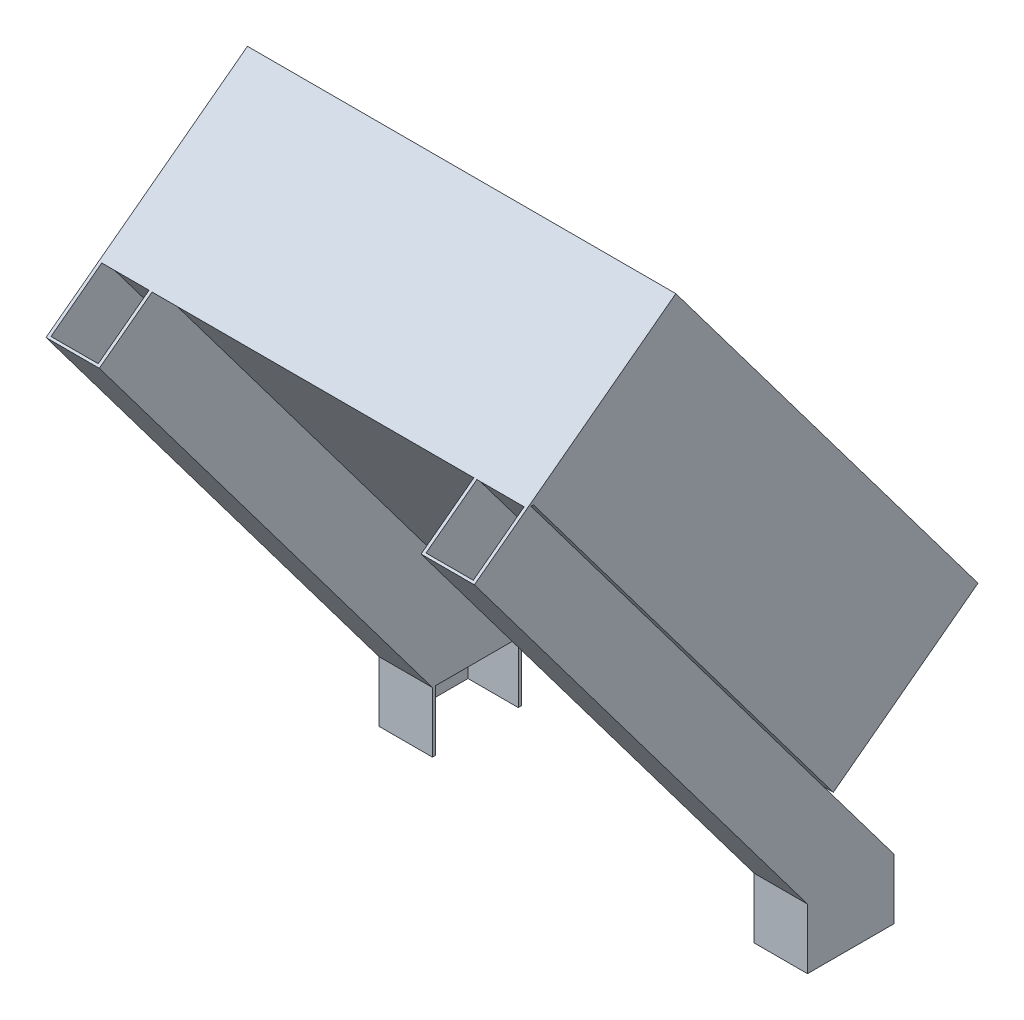
from build123d import *

# Parameters (mm, degrees)
BOSS_EXTRUDE1_DEPTH   = 30
BOSS_EXTRUDE1_2_DEPTH = 30
SWEEP1_START          = -106.5
SWEEP1_DEPTH          = 26.5
SWEEP1_2_DEPTH        = 1.5
SWEEP2_START          = 80
SWEEP2_DEPTH          = 26.5
SWEEP2_START_2        = 105
SWEEP2_2_DEPTH        = 1.5
BOSS_EXTRUDE2_DEPTH   = 1.5
BOSS_EXTRUDE3_DEPTH   = 1.5
SKETCH7_W             = 213
SKETCH7_H             = 44.192821834
BOSS_EXTRUDE4_DEPTH   = 1.5
BOSS_EXTRUDE5_REACH   = 392.115
SKETCH9_W             = 222.593563538
SKETCH9_H             = 76.90916357
CUT_EXTRUDE1_DEPTH    = 487.5


# Read off the part's stored shape, not the designer's step: Sweep1, Sweep2
with BuildPart() as part:
    # Sketch1 → Boss-Extrude1 (new body)
    with BuildSketch(Plane(origin=(0, 0, 0), x_dir=(1, 0, 0), z_dir=(0, 1, 0))):
        Polygon((-80, 0), (-80, -1.5), (-106.5, -1.5), (-106.5, 42.692821834), (-80, 42.692821834), (-80, 41.192821834), (-105, 41.192821834), (-105, 0), align=None)
    extrude(amount=BOSS_EXTRUDE1_DEPTH)

    # Sweep1 outline → Sweep1 (add)
    with BuildSketch(Plane.YZ.offset(SWEEP1_START)):
        Polygon((30, -42.692821834), (270, 137.764932896), (270, 139.264932896), (30, -41.192821834), align=None)
        Polygon((30, 0), (270, 180.45775473), (270, 181.95775473), (30, 1.5), align=None)
    extrude(amount=SWEEP1_DEPTH)

    # Sweep1 2 outline → Sweep1 2 (add)
    with BuildSketch(Plane.YZ.offset(SWEEP1_START)):
        Polygon((30, -41.192821834), (270, 139.264932896), (270, 180.45775473), (30, 0), align=None)
    extrude(amount=SWEEP1_2_DEPTH)

    # Sketch5 → Boss-Extrude2 (add)
    with BuildSketch(Plane(origin=(-80, 0, 0), x_dir=(0, 0, -1), z_dir=(1, 0, 0))):
        Polygon((0, 30), (-180.45775473, 270), (-139.264932896, 270), (41.192821834, 30), align=None)
    extrude(amount=-BOSS_EXTRUDE2_DEPTH)



with BuildPart() as body_2:
    # Sketch1 → Boss-Extrude1 2 (new body)
    with BuildSketch(Plane(origin=(0, 0, 0), x_dir=(1, 0, 0), z_dir=(0, 1, 0))):
        Polygon((80, 0), (105, 0), (105, 40), (80, 40), (80, 41.5), (106.5, 41.5), (106.5, -1.5), (80, -1.5), align=None)
    extrude(amount=BOSS_EXTRUDE1_2_DEPTH)

    # Sweep2 outline → Sweep2 (add)
    with BuildSketch(Plane.YZ.offset(SWEEP2_START)):
        Polygon((270, 180.45775473), (270, 181.95775473), (30, 1.5), (30, 0), align=None)
        Polygon((270, 138.95775473), (270, 140.45775473), (30, -40), (30, -41.5), align=None)
    extrude(amount=SWEEP2_DEPTH)

    # Sweep2 2 outline → Sweep2 2 (add)
    with BuildSketch(Plane.YZ.offset(SWEEP2_START_2)):
        Polygon((270, 140.45775473), (270, 180.45775473), (30, 0), (30, -40), align=None)
    extrude(amount=SWEEP2_2_DEPTH)

    # Sketch6 → Boss-Extrude3 (add)
    with BuildSketch(Plane.ZY.offset(-80)):
        Polygon((-40, 30), (140.45775473, 270), (180.45775473, 270), (0, 30), align=None)
    extrude(amount=-BOSS_EXTRUDE3_DEPTH)


with BuildPart() as part_1:
    add(part.part)

    add(body_2.part)  # Boss-Extrude4 merges body 2
    # Sketch7 → Boss-Extrude4 (add)
    with BuildSketch(Plane(origin=(0, 270, 0), x_dir=(1, 0, 0), z_dir=(0, 1, 0))):
        with Locations((0, -159.861343813)):
            Rectangle(SKETCH7_W, SKETCH7_H)
    extrude(amount=BOSS_EXTRUDE4_DEPTH)

    # Boss-Extrude5: up to this face of the body (flat: up to its plane)
    boss_extrude5_end = Plane(part_1.part.faces().sort_by_distance((106.5, 135.770686917, 60.769229512))[0])
    # Sketch8 → Boss-Extrude5 (add, up to the picked face)
    with BuildSketch(Plane.ZY.offset(106.5), mode=Mode.PRIVATE) as boss_extrude5_sk1:
        Polygon((-11.351006958, 71.683083011), (137.764932896, 270), (137.764932896, 271.5), (138.892793863, 271.5), (66.958703747, 325.587768295), (-83.285097074, 125.770851306), align=None)
    boss_extrude5_tool1 = split(extrude(boss_extrude5_sk1.sketch, amount=-BOSS_EXTRUDE5_REACH, mode=Mode.PRIVATE), bisect_by=boss_extrude5_end, keep=Keep.BOTH, mode=Mode.PRIVATE)
    add(boss_extrude5_tool1.solids().sort_by(Axis((-106.5, 198.632705, 27.7997), (1, 0, 0)))[0])

    # Sketch9 → Cut-Extrude1 (cut)
    with BuildSketch(Plane(origin=(0, 85.429976286, -113.617695949), x_dir=(-1, 0, 0), z_dir=(0, 0.6009752032818666, -0.7992676679563107))):
        with Locations((4.796781769, 338.926878661)):
            Rectangle(SKETCH9_W, SKETCH9_H)
    extrude(amount=-CUT_EXTRUDE1_DEPTH, mode=Mode.SUBTRACT)


solid = part_1.part
